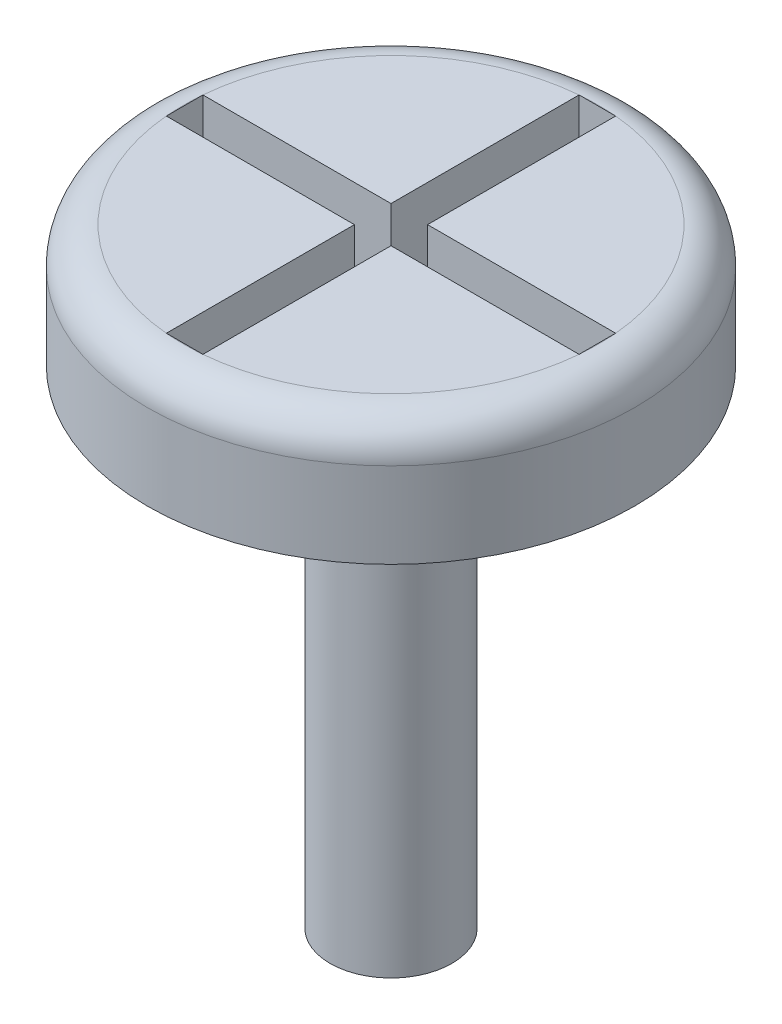
from build123d import *

# Parameters (mm, degrees)
SKETCH1_R           = 0.5
BOSS_EXTRUDE1_DEPTH = 5
SKETCH2_R           = 2
BOSS_EXTRUDE2_DEPTH = 1
FILLET1_R           = 0.3
CUT_EXTRUDE2_DEPTH  = 0.6


with BuildPart() as part:
    # Sketch1 → Boss-Extrude1 (new body)
    with BuildSketch(Plane(origin=(0, 0, 0), x_dir=(1, 0, 0), z_dir=(0, 1, 0))):
        Circle(SKETCH1_R)
    extrude(amount=BOSS_EXTRUDE1_DEPTH)

    # Sketch2 → Boss-Extrude2 (add)
    with BuildSketch(Plane(origin=(0, 5, 0), x_dir=(1, 0, 0), z_dir=(0, 1, 0))):
        Circle(SKETCH2_R)
    extrude(amount=-BOSS_EXTRUDE2_DEPTH)

    # Fillet1
    fillet1_edges = [part.edges().sort_by_distance(p)[0] for p in [
        (-2, 5, 0),
    ]]
    fillet(fillet1_edges, radius=FILLET1_R)

    # Sketch3 → Cut-Extrude2 (cut)
    with BuildSketch(Plane(origin=(0, 5, 0), x_dir=(1, 0, 0), z_dir=(0, 1, 0))):
        Polygon((-0.15, 0.15), (-0.15, 1.693369422), (0.15, 1.693369422), (0.15, 0.15), (1.693369422, 0.15), (1.693369422, -0.15), (0.15, -0.15), (0.15, -1.693369422), (-0.15, -1.693369422), (-0.15, -0.15), (-1.693369422, -0.15), (-1.693369422, 0.15), align=None)
    extrude(amount=-CUT_EXTRUDE2_DEPTH, mode=Mode.SUBTRACT)


solid = part.part
